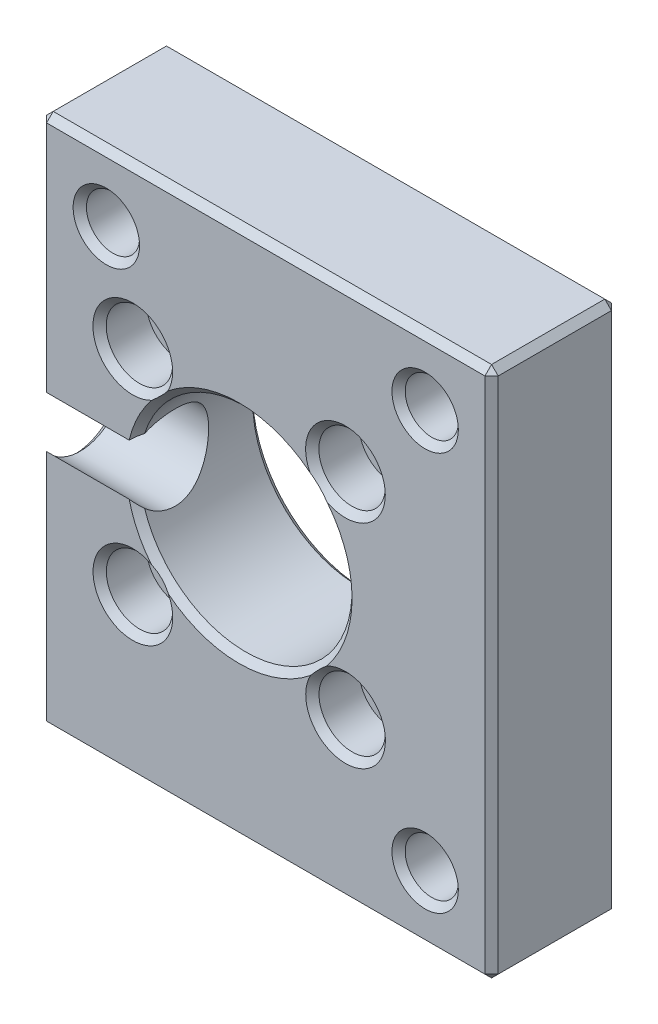
from build123d import *

# Parameters (mm, degrees)
SKETCH2_W           = 34
SKETCH2_H           = 40
SKETCH2_R           = 1.25
BOSS_EXTRUDE1_DEPTH = 9.525
SKETCH3_R           = 8
CUT_EXTRUDE1_DEPTH  = 30.184338694
SKETCH9_R           = 3.175
CUT_EXTRUDE8_DEPTH  = 15
CUT_EXTRUDE5_START  = -3.525
SKETCH4_R           = 1.25
CUT_EXTRUDE5_DEPTH  = 3.525
SKETCH7_R           = 2
CUT_EXTRUDE6_DEPTH  = 30.184338727
CUT_EXTRUDE7_START  = -5.525
SKETCH8_R           = 3.25
SKETCH8_R_2         = 2
CUT_EXTRUDE7_DEPTH  = 5.525


with BuildPart() as part:
    # Sketch2 → Boss-Extrude1 (new body)
    with BuildSketch(Plane.XY):
        with Locations((2, 0)):
            Rectangle(SKETCH2_W, SKETCH2_H)
        with Locations(Location((-8, -8, 0), (0, 0, 180))):
            Circle(SKETCH2_R, mode=Mode.SUBTRACT)
        with Locations(Location((8, -8, 0), (0, 0, 180))):
            Circle(SKETCH2_R, mode=Mode.SUBTRACT)
        with Locations(Location((-8, 8, 0), (0, 0, 180))):
            Circle(SKETCH2_R, mode=Mode.SUBTRACT)
        with Locations(Location((8, 8, 0), (0, 0, 180))):
            Circle(SKETCH2_R, mode=Mode.SUBTRACT)
    extrude(amount=BOSS_EXTRUDE1_DEPTH)

    # Sketch3 → Cut-Extrude1 (cut, through all)
    with BuildSketch(Plane(origin=(0, 0, 0), x_dir=(-1, 0, 0), z_dir=(0, 0, -1))):
        Circle(SKETCH3_R)
    extrude(amount=-CUT_EXTRUDE1_DEPTH, mode=Mode.SUBTRACT)

    # Sketch9 → Cut-Extrude8 (cut)
    with BuildSketch(Plane.ZY.offset(15)):
        with Locations((7, 0)):
            Circle(SKETCH9_R)
    extrude(amount=-CUT_EXTRUDE8_DEPTH, mode=Mode.SUBTRACT)

    # Sketch4 → Cut-Extrude5 (cut)
    # profile 1 of 9: a face of its own
    with BuildSketch(Plane.XY.offset(9.525).offset(CUT_EXTRUDE5_START)):
        with BuildLine():
            Line((-8.01, 10), (-6.496758446, 10))
            ThreePointArc((-6.496758446, 10), (-9.777766953, 9.777766953), (-10, 6.496758446))
            Line((-10, 6.496758446), (-10, 8.01))
            ThreePointArc((-10, 8.01), (-9.417142495, 9.417142495), (-8.01, 10))
        make_face()
    # profile 2 of 9: a face of its own
    with BuildSketch(Plane.XY.offset(9.525).offset(CUT_EXTRUDE5_START)):
        with BuildLine():
            ThreePointArc((-5.51, 8.01), (-5.770233954, 9.120607067), (-6.496758446, 10))
            Line((-6.496758446, 10), (-8.01, 10))
            ThreePointArc((-8.01, 10), (-9.417142495, 9.417142495), (-10, 8.01))
            Line((-10, 8.01), (-10, 6.496758446))
            ThreePointArc((-10, 6.496758446), (-7.211564029, 5.640928452), (-5.51, 8.01))
        make_face()
        with Locations(Location((-8, 8, 0), (0, 0, 180))):
            Circle(SKETCH4_R, mode=Mode.SUBTRACT)
    # profile 3 of 9: a face of its own
    with BuildSketch(Plane.XY.offset(9.525).offset(CUT_EXTRUDE5_START)):
        with BuildLine():
            ThreePointArc((6.5, 10), (6.232233047, 6.232233047), (10, 6.5))
            Line((10, 6.5), (10, 8.01))
            ThreePointArc((10, 8.01), (9.417142495, 9.417142495), (8.01, 10))
            Line((8.01, 10), (6.5, 10))
        make_face()
        with Locations(Location((8, 8, 0), (0, 0, 180))):
            Circle(SKETCH4_R, mode=Mode.SUBTRACT)
    # profile 4 of 9: a face of its own
    with BuildSketch(Plane.XY.offset(9.525).offset(CUT_EXTRUDE5_START)):
        with BuildLine():
            Line((10, 8.01), (10, 6.5))
            ThreePointArc((10, 6.5), (10.371708245, 7.209430585), (10.5, 8))
            ThreePointArc((10.5, 8), (9.118033989, 10.236067977), (6.5, 10))
            Line((6.5, 10), (8.01, 10))
            ThreePointArc((8.01, 10), (9.417142495, 9.417142495), (10, 8.01))
        make_face()
    # profile 5 of 9: a face of its own
    with BuildSketch(Plane.XY.offset(9.525).offset(CUT_EXTRUDE5_START)):
        with BuildLine():
            ThreePointArc((-10, -6.5), (-9.767766953, -9.767766953), (-6.5, -10))
            Line((-6.5, -10), (-8.01, -10))
            ThreePointArc((-8.01, -10), (-9.417142495, -9.417142495), (-10, -8.01))
            Line((-10, -8.01), (-10, -6.5))
        make_face()
    # profile 6 of 9: a face of its own
    with BuildSketch(Plane.XY.offset(9.525).offset(CUT_EXTRUDE5_START)):
        with BuildLine():
            Line((-8.01, -10), (-6.5, -10))
            ThreePointArc((-6.5, -10), (-5.763932022, -9.118033989), (-5.5, -8))
            ThreePointArc((-5.5, -8), (-7.209430585, -5.628291755), (-10, -6.5))
            Line((-10, -6.5), (-10, -8.01))
            ThreePointArc((-10, -8.01), (-9.417142495, -9.417142495), (-8.01, -10))
        make_face()
        with Locations(Location((-8, -8, 0), (0, 0, 180))):
            Circle(SKETCH4_R, mode=Mode.SUBTRACT)
    # profile 7 of 9: a face of its own
    with BuildSketch(Plane.XY.offset(9.525).offset(CUT_EXTRUDE5_START)):
        with BuildLine():
            Line((10, -6.496758446), (10, -8.01))
            ThreePointArc((10, -8.01), (9.417142495, -9.417142495), (8.01, -10))
            Line((8.01, -10), (6.496758446, -10))
            ThreePointArc((6.496758446, -10), (9.120607067, -10.249766046), (10.51, -8.01))
            ThreePointArc((10.51, -8.01), (10.379071548, -7.211564029), (10, -6.496758446))
        make_face()
    # profile 8 of 9: a face of its own
    with BuildSketch(Plane.XY.offset(9.525).offset(CUT_EXTRUDE5_START)):
        with BuildLine():
            ThreePointArc((8.01, -10), (9.417142495, -9.417142495), (10, -8.01))
            Line((10, -8.01), (10, -6.496758446))
            ThreePointArc((10, -6.496758446), (6.242233047, -6.242233047), (6.496758446, -10))
            Line((6.496758446, -10), (8.01, -10))
        make_face()
        with Locations(Location((8, -8, 0), (0, 0, 180))):
            Circle(SKETCH4_R, mode=Mode.SUBTRACT)
    # profile 9 of 9: a face of its own
    with BuildSketch(Plane.XY.offset(9.525).offset(CUT_EXTRUDE5_START)):
        with Locations(Location((8, 8, 0), (0, 0, 180))):
            Circle(SKETCH4_R)
    extrude(amount=CUT_EXTRUDE5_DEPTH, mode=Mode.SUBTRACT)

    # Sketch7 → Cut-Extrude6 (cut, through all)
    with BuildSketch(Plane.XY.offset(9.525)):
        with Locations((-10, 15)):
            Circle(SKETCH7_R)
        with Locations((14, 15)):
            Circle(SKETCH7_R)
        with Locations((14, -15)):
            Circle(SKETCH7_R)
    extrude(amount=-CUT_EXTRUDE6_DEPTH, mode=Mode.SUBTRACT)

    # Sketch8 → Cut-Extrude7 (cut)
    # profile 1 of 3: a face of its own
    with BuildSketch(Plane(origin=(0, 0, 0), x_dir=(-1, 0, 0), z_dir=(0, 0, -1)).offset(CUT_EXTRUDE7_START)):
        with Locations((-14, -15)):
            Circle(SKETCH8_R)
        with Locations(Location((-14, -15, 0), (0, 0, 180))):
            Circle(SKETCH8_R_2, mode=Mode.SUBTRACT)
    # profile 2 of 3: a face of its own
    with BuildSketch(Plane(origin=(0, 0, 0), x_dir=(-1, 0, 0), z_dir=(0, 0, -1)).offset(CUT_EXTRUDE7_START)):
        with Locations((10, 15)):
            Circle(SKETCH8_R)
        with Locations(Location((10, 15, 0), (0, 0, 180))):
            Circle(SKETCH8_R_2, mode=Mode.SUBTRACT)
    # profile 3 of 3: a face of its own
    with BuildSketch(Plane(origin=(0, 0, 0), x_dir=(-1, 0, 0), z_dir=(0, 0, -1)).offset(CUT_EXTRUDE7_START)):
        with Locations((-14, 15)):
            Circle(SKETCH8_R)
        with Locations(Location((-14, 15, 0), (0, 0, 180))):
            Circle(SKETCH8_R_2, mode=Mode.SUBTRACT)
    extrude(amount=CUT_EXTRUDE7_DEPTH, mode=Mode.SUBTRACT)

    # Chamfer1
    # the kernel refuses this chamfer: 0.5 mm, written as the material it takes off along each edge
    with BuildSketch(Plane(origin=(18.666666667, 19.666666667, 0.333333333), x_dir=(0.7071067811865475, -0.7071067811865475, 0), z_dir=(0.5773502691896258, 0.5773502691896258, -0.5773502691896258)), Plane(origin=(-14.666666667, 19.666666667, 9.191666667), x_dir=(-0.7071067811865475, -0.7071067811865475, 0), z_dir=(-0.5773502691896265, 0.5773502691896265, 0.5773502691896244)), Plane(origin=(18.666666667, -19.666666667, 9.191666667), x_dir=(-0.7071067811865475, 0, 0.7071067811865475), z_dir=(0.5773502691896258, -0.5773502691896258, 0.5773502691896258)), Plane(origin=(-14.666666667, -19.666666667, 0.333333333), x_dir=(0.7071067811865464, 0, -0.7071067811865487), z_dir=(-0.5773502691896264, -0.5773502691896264, -0.5773502691896244))) as chamfer1_piece_1:
        Polygon((-0.353553391, -0.204124145), (0.353553391, -0.204124145), (0, 0.40824829), align=None)
    extrude(amount=0.635085296, mode=Mode.SUBTRACT)
    with BuildSketch(Plane(origin=(-14.666666667, 19.666666667, 0.333333333), x_dir=(-0.7071067811865475, -0.7071067811865475, 0), z_dir=(-0.5773502691896265, 0.5773502691896265, -0.5773502691896244)), Plane(origin=(18.666666667, 19.666666667, 9.191666667), x_dir=(0.7071067811865475, -0.7071067811865475, 0), z_dir=(0.5773502691896258, 0.5773502691896258, 0.5773502691896258)), Plane(origin=(18.666666667, -19.666666667, 0.333333333), x_dir=(-0.7071067811865475, 0, -0.7071067811865475), z_dir=(0.5773502691896258, -0.5773502691896258, -0.5773502691896258)), Plane(origin=(-14.666666667, -19.666666667, 9.191666667), x_dir=(0.7071067811865464, 0, 0.7071067811865488), z_dir=(-0.5773502691896265, -0.5773502691896265, 0.5773502691896244))) as chamfer1_piece_2:
        Polygon((-0.353553391, 0.204124145), (0.353553391, 0.204124145), (0, -0.40824829), align=None)
    extrude(amount=0.635085296, mode=Mode.SUBTRACT)
    with BuildSketch(Plane(origin=(14, -15, 9.525), x_dir=(1, 0, 0), z_dir=(0, -1, 0))) as chamfer1_piece_3:
        with BuildLine():
            Line((2.514142136, 0.014142136), (1.985857864, -0.514142136))
            Line((1.985857864, -0.514142136), (1.975857864, -0.514142136))
            ThreePointArc((1.975857864, -0.514142136), (1.99, -0.257071068), (1.99, 0))
            Line((1.99, 0), (2, 0.01))
            ThreePointArc((2, 0.01), (2.257071068, 0.01), (2.514142136, 0.024142136))
            Line((2.514142136, 0.024142136), (2.514142136, 0.014142136))
        make_face()
    revolve(axis=Axis((14, -15, 9.525), (0, 0, 1)), mode=Mode.SUBTRACT)
    with BuildSketch(Plane(origin=(8.01, -8.01, 9.525), x_dir=(-0.60529662150061, -0.795999999999967, 0), z_dir=(-0.795999999999967, 0.60529662150061, 0))) as chamfer1_piece_4:
        with BuildLine():
            Line((3.014142136, 0.014142136), (2.485857864, -0.514142136))
            Line((2.485857864, -0.514142136), (2.475857864, -0.514142136))
            ThreePointArc((2.475857864, -0.514142136), (2.49, -0.257071068), (2.49, 0))
            Line((2.49, 0), (2.5, 0.01))
            ThreePointArc((2.5, 0.01), (2.757071068, 0.01), (3.014142136, 0.024142136))
            Line((3.014142136, 0.024142136), (3.014142136, 0.014142136))
        make_face()
    revolve(axis=Axis((8.01, -8.01, 9.525), (0, 0, 1)), mode=Mode.SUBTRACT)
    with BuildSketch(Plane(origin=(-8, -8, 9.525), x_dir=(-0.8000000000137726, 0.5999999999816367, 0), z_dir=(-0.5999999999816367, -0.8000000000137726, 0))) as chamfer1_piece_5:
        with BuildLine():
            Line((3.014142136, -0.014142136), (2.485857864, 0.514142136))
            Line((2.485857864, 0.514142136), (2.475857864, 0.514142136))
            ThreePointArc((2.475857864, 0.514142136), (2.49, 0.257071068), (2.49, 0))
            Line((2.49, 0), (2.5, -0.01))
            ThreePointArc((2.5, -0.01), (2.757071068, -0.01), (3.014142136, -0.024142136))
            Line((3.014142136, -0.024142136), (3.014142136, -0.014142136))
        make_face()
    revolve(axis=Axis((-8, -8, 9.525), (0, 0, -1)), mode=Mode.SUBTRACT)
    with BuildSketch(Plane(origin=(0, 0, 9.525), x_dir=(-0.9966907956199649, 0.08128627145121996, 0), z_dir=(-0.08128627145121996, -0.9966907956199649, 0))) as chamfer1_piece_6:
        with BuildLine():
            Line((8.514142136, -0.014142136), (7.985857864, 0.514142136))
            Line((7.985857864, 0.514142136), (7.975857864, 0.514142136))
            ThreePointArc((7.975857864, 0.514142136), (7.99, 0.257071068), (7.99, 0))
            Line((7.99, 0), (8, -0.01))
            ThreePointArc((8, -0.01), (8.257071068, -0.01), (8.514142136, -0.024142136))
            Line((8.514142136, -0.024142136), (8.514142136, -0.014142136))
        make_face()
    revolve(axis=Axis((0, 0, 9.525), (0, 0, -1)), revolution_arc=350.674991036, mode=Mode.SUBTRACT)
    with BuildSketch(Plane(origin=(8, 8, 9.525), x_dir=(0.7999999999862503, -0.6000000000183331, 0), z_dir=(0.6000000000183331, 0.7999999999862503, 0))) as chamfer1_piece_7:
        with BuildLine():
            Line((3.014142136, -0.014142136), (2.485857864, 0.514142136))
            Line((2.485857864, 0.514142136), (2.475857864, 0.514142136))
            ThreePointArc((2.475857864, 0.514142136), (2.49, 0.257071068), (2.49, 0))
            Line((2.49, 0), (2.5, -0.01))
            ThreePointArc((2.5, -0.01), (2.757071068, -0.01), (3.014142136, -0.024142136))
            Line((3.014142136, -0.024142136), (3.014142136, -0.014142136))
        make_face()
    revolve(axis=Axis((8, 8, 9.525), (0, 0, -1)), mode=Mode.SUBTRACT)
    with BuildSketch(Plane(origin=(-8.01, 8.01, 9.525), x_dir=(0.6052966215005352, 0.7960000000000238, 0), z_dir=(-0.7960000000000238, 0.6052966215005352, 0))) as chamfer1_piece_8:
        with BuildLine():
            Line((3.014142136, -0.014142136), (2.485857864, 0.514142136))
            Line((2.485857864, 0.514142136), (2.475857864, 0.514142136))
            ThreePointArc((2.475857864, 0.514142136), (2.49, 0.257071068), (2.49, 0))
            Line((2.49, 0), (2.5, -0.01))
            ThreePointArc((2.5, -0.01), (2.757071068, -0.01), (3.014142136, -0.024142136))
            Line((3.014142136, -0.024142136), (3.014142136, -0.014142136))
        make_face()
    revolve(axis=Axis((-8.01, 8.01, 9.525), (0, 0, -1)), mode=Mode.SUBTRACT)
    with BuildSketch(Plane(origin=(-10, 15, 9.525), x_dir=(1, 0, 0), z_dir=(0, -1, 0))) as chamfer1_piece_9:
        with BuildLine():
            Line((2.514142136, 0.014142136), (1.985857864, -0.514142136))
            Line((1.985857864, -0.514142136), (1.975857864, -0.514142136))
            ThreePointArc((1.975857864, -0.514142136), (1.99, -0.257071068), (1.99, 0))
            Line((1.99, 0), (2, 0.01))
            ThreePointArc((2, 0.01), (2.257071068, 0.01), (2.514142136, 0.024142136))
            Line((2.514142136, 0.024142136), (2.514142136, 0.014142136))
        make_face()
    revolve(axis=Axis((-10, 15, 9.525), (0, 0, 1)), mode=Mode.SUBTRACT)
    with BuildSketch(Plane(origin=(14, 15, 9.525), x_dir=(1, 0, 0), z_dir=(0, -1, 0))) as chamfer1_piece_10:
        with BuildLine():
            Line((2.514142136, 0.014142136), (1.985857864, -0.514142136))
            Line((1.985857864, -0.514142136), (1.975857864, -0.514142136))
            ThreePointArc((1.975857864, -0.514142136), (1.99, -0.257071068), (1.99, 0))
            Line((1.99, 0), (2, 0.01))
            ThreePointArc((2, 0.01), (2.257071068, 0.01), (2.514142136, 0.024142136))
            Line((2.514142136, 0.024142136), (2.514142136, 0.014142136))
        make_face()
    revolve(axis=Axis((14, 15, 9.525), (0, 0, 1)), mode=Mode.SUBTRACT)
    with BuildSketch(Plane(origin=(-10, 15, 0), x_dir=(-1, 0, 0), z_dir=(0, -1, 0))) as chamfer1_piece_11:
        with BuildLine():
            Line((3.764142136, 0.014142136), (3.235857864, -0.514142136))
            Line((3.235857864, -0.514142136), (3.225857864, -0.514142136))
            ThreePointArc((3.225857864, -0.514142136), (3.24, -0.257071068), (3.24, 0))
            Line((3.24, 0), (3.25, 0.01))
            ThreePointArc((3.25, 0.01), (3.507071068, 0.01), (3.764142136, 0.024142136))
            Line((3.764142136, 0.024142136), (3.764142136, 0.014142136))
        make_face()
    revolve(axis=Axis((-10, 15, 0), (0, 0, -1)), mode=Mode.SUBTRACT)
    with BuildSketch(Plane(origin=(14, 15, 0), x_dir=(-1, 0, 0), z_dir=(0, -1, 0))) as chamfer1_piece_12:
        with BuildLine():
            Line((3.764142136, 0.014142136), (3.235857864, -0.514142136))
            Line((3.235857864, -0.514142136), (3.225857864, -0.514142136))
            ThreePointArc((3.225857864, -0.514142136), (3.24, -0.257071068), (3.24, 0))
            Line((3.24, 0), (3.25, 0.01))
            ThreePointArc((3.25, 0.01), (3.507071068, 0.01), (3.764142136, 0.024142136))
            Line((3.764142136, 0.024142136), (3.764142136, 0.014142136))
        make_face()
    revolve(axis=Axis((14, 15, 0), (0, 0, -1)), mode=Mode.SUBTRACT)
    with BuildSketch(Plane(origin=(8, 8, 0), x_dir=(-1, 0, 0), z_dir=(0, 1, 0))) as chamfer1_piece_13:
        with BuildLine():
            Line((1.764142136, -0.014142136), (1.235857864, 0.514142136))
            Line((1.235857864, 0.514142136), (1.225857864, 0.514142136))
            ThreePointArc((1.225857864, 0.514142136), (1.24, 0.257071068), (1.24, 0))
            Line((1.24, 0), (1.25, -0.01))
            ThreePointArc((1.25, -0.01), (1.507071068, -0.01), (1.764142136, -0.024142136))
            Line((1.764142136, -0.024142136), (1.764142136, -0.014142136))
        make_face()
    revolve(axis=Axis((8, 8, 0), (0, 0, 1)), mode=Mode.SUBTRACT)
    with BuildSketch(Plane(origin=(-8, 8, 0), x_dir=(-1, 0, 0), z_dir=(0, 1, 0))) as chamfer1_piece_14:
        with BuildLine():
            Line((1.764142136, -0.014142136), (1.235857864, 0.514142136))
            Line((1.235857864, 0.514142136), (1.225857864, 0.514142136))
            ThreePointArc((1.225857864, 0.514142136), (1.24, 0.257071068), (1.24, 0))
            Line((1.24, 0), (1.25, -0.01))
            ThreePointArc((1.25, -0.01), (1.507071068, -0.01), (1.764142136, -0.024142136))
            Line((1.764142136, -0.024142136), (1.764142136, -0.014142136))
        make_face()
    revolve(axis=Axis((-8, 8, 0), (0, 0, 1)), mode=Mode.SUBTRACT)
    with BuildSketch(Plane(origin=(0, 0, 0), x_dir=(-1, 0, 0), z_dir=(0, -1, 0))) as chamfer1_piece_15:
        with BuildLine():
            Line((8.514142136, 0.014142136), (7.985857864, -0.514142136))
            Line((7.985857864, -0.514142136), (7.975857864, -0.514142136))
            ThreePointArc((7.975857864, -0.514142136), (7.99, -0.257071068), (7.99, 0))
            Line((7.99, 0), (8, 0.01))
            ThreePointArc((8, 0.01), (8.257071068, 0.01), (8.514142136, 0.024142136))
            Line((8.514142136, 0.024142136), (8.514142136, 0.014142136))
        make_face()
    revolve(axis=Axis((0, 0, 0), (0, 0, -1)), mode=Mode.SUBTRACT)
    with BuildSketch(Plane(origin=(-8, -8, 0), x_dir=(-1, 0, 0), z_dir=(0, 1, 0))) as chamfer1_piece_16:
        with BuildLine():
            Line((1.764142136, -0.014142136), (1.235857864, 0.514142136))
            Line((1.235857864, 0.514142136), (1.225857864, 0.514142136))
            ThreePointArc((1.225857864, 0.514142136), (1.24, 0.257071068), (1.24, 0))
            Line((1.24, 0), (1.25, -0.01))
            ThreePointArc((1.25, -0.01), (1.507071068, -0.01), (1.764142136, -0.024142136))
            Line((1.764142136, -0.024142136), (1.764142136, -0.014142136))
        make_face()
    revolve(axis=Axis((-8, -8, 0), (0, 0, 1)), mode=Mode.SUBTRACT)
    with BuildSketch(Plane(origin=(14, -15, 0), x_dir=(-1, 0, 0), z_dir=(0, -1, 0))) as chamfer1_piece_17:
        with BuildLine():
            Line((3.764142136, 0.014142136), (3.235857864, -0.514142136))
            Line((3.235857864, -0.514142136), (3.225857864, -0.514142136))
            ThreePointArc((3.225857864, -0.514142136), (3.24, -0.257071068), (3.24, 0))
            Line((3.24, 0), (3.25, 0.01))
            ThreePointArc((3.25, 0.01), (3.507071068, 0.01), (3.764142136, 0.024142136))
            Line((3.764142136, 0.024142136), (3.764142136, 0.014142136))
        make_face()
    revolve(axis=Axis((14, -15, 0), (0, 0, -1)), mode=Mode.SUBTRACT)
    with BuildSketch(Plane(origin=(8, -8, 0), x_dir=(-1, 0, 0), z_dir=(0, 1, 0))) as chamfer1_piece_18:
        with BuildLine():
            Line((1.764142136, -0.014142136), (1.235857864, 0.514142136))
            Line((1.235857864, 0.514142136), (1.225857864, 0.514142136))
            ThreePointArc((1.225857864, 0.514142136), (1.24, 0.257071068), (1.24, 0))
            Line((1.24, 0), (1.25, -0.01))
            ThreePointArc((1.25, -0.01), (1.507071068, -0.01), (1.764142136, -0.024142136))
            Line((1.764142136, -0.024142136), (1.764142136, -0.014142136))
        make_face()
    revolve(axis=Axis((8, -8, 0), (0, 0, 1)), mode=Mode.SUBTRACT)
    with BuildSketch(Plane(origin=(20.285841494, 20, 0), x_dir=(0, 0.02749587661058908, 0.9996219169112968), z_dir=(-1, 0, 0)), Plane(origin=(-16.285841494, -20, 9.525), x_dir=(0, 0.9996219169112968, 0.02749587661058555), z_dir=(1, 0, 0))) as chamfer1_piece_19:
        with BuildLine():
            Line((0.514336598, 0), (-0.028273577, -0.513558897))
            Line((-0.028273577, -0.513558897), (-0.038269797, -0.513283938))
            ThreePointArc((-0.038269797, -0.513283938), (-0.017064614, -0.256698915), (-0.009996219, 0.000274959))
            Line((-0.009996219, 0.000274959), (0.000274959, 0.009996219))
            ThreePointArc((0.000274959, 0.009996219), (0.257248832, 0.002927825), (0.514611556, 0.009996219))
            Line((0.514611556, 0.009996219), (0.514336598, 0))
        make_face()
    extrude(amount=36.571682988, mode=Mode.SUBTRACT)
    with BuildSketch(Plane(origin=(20.285841494, 20, 9.525), x_dir=(0, 0.0274958766105891, -0.9996219169112968), z_dir=(-1, 0, 0)), Plane(origin=(-16.285841494, -20, 0), x_dir=(0, 0.9996219169112968, -0.027495876610586292), z_dir=(1, 0, 0))) as chamfer1_piece_20:
        with BuildLine():
            Line((0.514336598, 0), (-0.028273577, 0.513558897))
            Line((-0.028273577, 0.513558897), (-0.038269797, 0.513283938))
            ThreePointArc((-0.038269797, 0.513283938), (-0.017064614, 0.256698915), (-0.009996219, -0.000274959))
            Line((-0.009996219, -0.000274959), (0.000274959, -0.009996219))
            ThreePointArc((0.000274959, -0.009996219), (0.257248832, -0.002927825), (0.514611556, -0.009996219))
            Line((0.514611556, -0.009996219), (0.514336598, 0))
        make_face()
    extrude(amount=36.571682988, mode=Mode.SUBTRACT)
    with BuildSketch(Plane(origin=(19, -21.285841494, 0), x_dir=(0.02749587661058908, 0, 0.9996219169112968), z_dir=(0, 1, 0)), Plane(origin=(-15, 21.285841494, 0), x_dir=(-0.027495876610585623, 0, 0.9996219169112968), z_dir=(0, -1, 0))) as chamfer1_piece_21:
        with BuildLine():
            Line((0.514336598, 0), (-0.028273577, -0.513558897))
            Line((-0.028273577, -0.513558897), (-0.038269797, -0.513283938))
            ThreePointArc((-0.038269797, -0.513283938), (-0.017064614, -0.256698915), (-0.009996219, 0.000274959))
            Line((-0.009996219, 0.000274959), (0.000274959, 0.009996219))
            ThreePointArc((0.000274959, 0.009996219), (0.257248832, 0.002927825), (0.514611556, 0.009996219))
            Line((0.514611556, 0.009996219), (0.514336598, 0))
        make_face()
    extrude(amount=42.571682988, mode=Mode.SUBTRACT)
    with BuildSketch(Plane(origin=(19, -21.285841494, 9.525), x_dir=(0.0274958766105891, 0, -0.9996219169112968), z_dir=(0, 1, 0))) as chamfer1_piece_22:
        with BuildLine():
            Line((0.514336598, 0), (-0.028273577, 0.513558897))
            Line((-0.028273577, 0.513558897), (-0.038269797, 0.513283938))
            ThreePointArc((-0.038269797, 0.513283938), (-0.017064614, 0.256698915), (-0.009996219, -0.000274959))
            Line((-0.009996219, -0.000274959), (0.000274959, -0.009996219))
            ThreePointArc((0.000274959, -0.009996219), (0.257248832, -0.002927825), (0.514611556, -0.009996219))
            Line((0.514611556, -0.009996219), (0.514336598, 0))
        make_face()
    extrude(amount=42.571682988, mode=Mode.SUBTRACT)
    with BuildSketch(Plane(origin=(19, 20, -1.285841494), x_dir=(-0.9996219169112968, 0.027495876610589005, 0), z_dir=(0, 0, 1)), Plane(origin=(19, -20, -1.285841494), x_dir=(0.027495876610589005, 0.9996219169112968, 0), z_dir=(0, 0, 1))) as chamfer1_piece_23:
        with BuildLine():
            Line((0.514336598, 0), (-0.028273577, 0.513558897))
            Line((-0.028273577, 0.513558897), (-0.038269797, 0.513283938))
            ThreePointArc((-0.038269797, 0.513283938), (-0.017064614, 0.256698915), (-0.009996219, -0.000274959))
            Line((-0.009996219, -0.000274959), (0.000274959, -0.009996219))
            ThreePointArc((0.000274959, -0.009996219), (0.257248832, -0.002927825), (0.514611556, -0.009996219))
            Line((0.514611556, -0.009996219), (0.514336598, 0))
        make_face()
    extrude(amount=12.096682988, mode=Mode.SUBTRACT)
    with BuildSketch(Plane(origin=(-15, 20, -1.285841494), x_dir=(0.9996219169112968, 0.0274958766105891, 0), z_dir=(0, 0, 1)), Plane(origin=(-15, -20, -1.285841494), x_dir=(-0.02749587661058555, 0.9996219169112968, 0), z_dir=(0, 0, 1))) as chamfer1_piece_24:
        with BuildLine():
            Line((0.514336598, 0), (-0.028273577, -0.513558897))
            Line((-0.028273577, -0.513558897), (-0.038269797, -0.513283938))
            ThreePointArc((-0.038269797, -0.513283938), (-0.017064614, -0.256698915), (-0.009996219, 0.000274959))
            Line((-0.009996219, 0.000274959), (0.000274959, 0.009996219))
            ThreePointArc((0.000274959, 0.009996219), (0.257248832, 0.002927825), (0.514611556, 0.009996219))
            Line((0.514611556, 0.009996219), (0.514336598, 0))
        make_face()
    extrude(amount=12.096682988, mode=Mode.SUBTRACT)
    with BuildSketch(Plane(origin=(-15, 21.285841494, 9.525), x_dir=(-0.027495876610585647, 0, -0.9996219169112968), z_dir=(0, -1, 0)), Plane(origin=(-15, -0.638996162, 9.525), x_dir=(-0.027495876610585647, 0, -0.9996219169112968), z_dir=(0, -1, 0))) as chamfer1_piece_25:
        with BuildLine():
            Line((0.514336598, 0), (-0.028273577, 0.513558897))
            Line((-0.028273577, 0.513558897), (-0.038269797, 0.513283938))
            ThreePointArc((-0.038269797, 0.513283938), (-0.017064614, 0.256698915), (-0.009996219, -0.000274959))
            Line((-0.009996219, -0.000274959), (0.000274959, -0.009996219))
            ThreePointArc((0.000274959, -0.009996219), (0.257248832, -0.002927825), (0.514611556, -0.009996219))
            Line((0.514611556, -0.009996219), (0.514336598, 0))
        make_face()
    extrude(amount=20.646845332, mode=Mode.SUBTRACT)
    with BuildSketch(Plane(origin=(-15, 0, 7), x_dir=(0, 0.24227025037133326, 0.9702088052501953), z_dir=(0, -0.9702088052501953, 0.24227025037133326))) as chamfer1_piece_26:
        with BuildLine():
            Line((3.689142136, 0.014142136), (3.160857864, -0.514142136))
            Line((3.160857864, -0.514142136), (3.150857864, -0.514142136))
            ThreePointArc((3.150857864, -0.514142136), (3.165, -0.257071068), (3.165, 0))
            Line((3.165, 0), (3.175, 0.01))
            ThreePointArc((3.175, 0.01), (3.432071068, 0.01), (3.689142136, 0.024142136))
            Line((3.689142136, 0.024142136), (3.689142136, 0.014142136))
        make_face()
    revolve(axis=Axis((-15, 0, 7), (-1, 0, 0)), revolution_arc=331.958857591, mode=Mode.SUBTRACT)


solid = part.part
